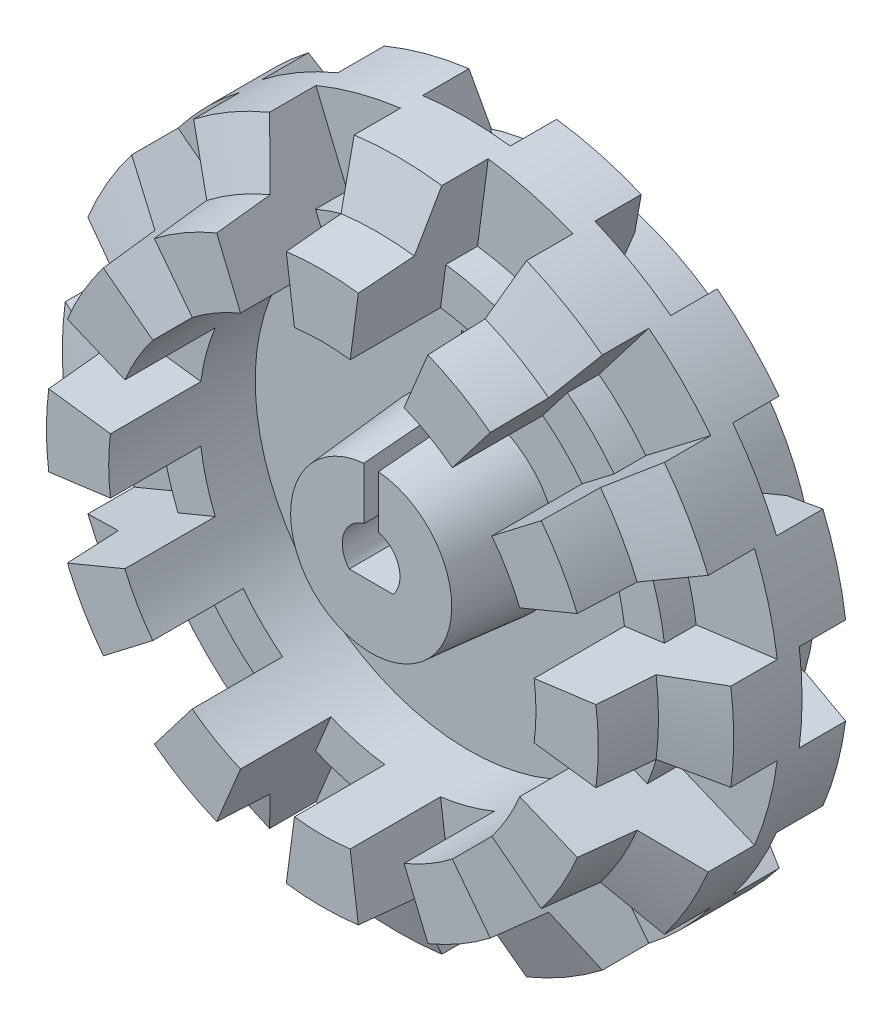
from build123d import *
from build123d.topology import SkipClean

# Parameters (mm, degrees)
SKETCH1_R           = 17.4625
BOSS_EXTRUDE1_DEPTH = 1.143
BOSS_EXTRUDE2_DEPTH = 6.35
SKETCH4_R           = 4.6355
BOSS_EXTRUDE3_DEPTH = 3.81
SKETCH5_R           = 4.064
BOSS_EXTRUDE4_DEPTH = 5.08
BOSS_EXTRUDE5_START = 3.175
BOSS_EXTRUDE5_DEPTH = 3.175
BOSS_EXTRUDE6_START = 5.08
SKETCH7_R           = 13.081
SKETCH7_R_2         = 10.414
BOSS_EXTRUDE6_DEPTH = 5.08
SKETCH11_R          = 13.208
SKETCH11_R_2        = 11.1125
BOSS_EXTRUDE7_DEPTH = 1.651
BOSS_EXTRUDE8_START = 1.27
SKETCH12_R          = 10.414
BOSS_EXTRUDE8_DEPTH = 1.27
DRAFT2_ANGLE        = 5
CUT_EXTRUDE1_DEPTH  = 27.655935577
CUT_EXTRUDE2_START  = -1.27
SKETCH13_R          = 11.1125
SKETCH13_R_2        = 4.6355
CUT_EXTRUDE2_DEPTH  = 1.27


# Read off the part's stored shape, not the designer's step: Draft1
with BuildPart() as part:
    # Sketch1 → Boss-Extrude1 (new body)
    with BuildSketch(Plane.XY):
        Circle(SKETCH1_R)
    extrude(amount=BOSS_EXTRUDE1_DEPTH)

    # Sketch2 → Boss-Extrude2 (add)
    with BuildSketch(Plane.XY.offset(1.143)):
        with BuildLine():
            ThreePointArc((-1.450472311, 11.017431022), (0, 11.1125), (1.450472311, 11.017431022))
            Line((1.450472311, 11.017431022), (2.279313632, 17.313105892))
            ThreePointArc((2.279313632, 17.313105892), (0, 17.4625), (-2.279313632, 17.313105892))
            Line((-2.279313632, 17.313105892), (-1.450472311, 11.017431022))
        make_face()
        with BuildLine():
            ThreePointArc((4.252569642, 10.266611305), (5.55625, 9.6237073), (6.76486138, 8.816138994))
            Line((6.76486138, 8.816138994), (10.630496454, 13.853932705))
            ThreePointArc((10.630496454, 13.853932705), (8.73125, 15.122968614), (6.682609438, 16.133246336))
            Line((6.682609438, 16.133246336), (4.252569642, 10.266611305))
        make_face()
        with BuildLine():
            ThreePointArc((8.816138994, 6.76486138), (9.6237073, 5.55625), (10.266611305, 4.252569642))
            Line((10.266611305, 4.252569642), (16.133246336, 6.682609438))
            ThreePointArc((16.133246336, 6.682609438), (15.122968614, 8.73125), (13.853932705, 10.630496454))
            Line((13.853932705, 10.630496454), (8.816138994, 6.76486138))
        make_face()
        with BuildLine():
            ThreePointArc((11.017431022, 1.450472311), (11.1125, 0), (11.017431022, -1.450472311))
            Line((11.017431022, -1.450472311), (17.313105892, -2.279313632))
            ThreePointArc((17.313105892, -2.279313632), (17.4625, 0), (17.313105892, 2.279313632))
            Line((17.313105892, 2.279313632), (11.017431022, 1.450472311))
        make_face()
        with BuildLine():
            ThreePointArc((10.266611305, -4.252569642), (9.6237073, -5.55625), (8.816138994, -6.76486138))
            Line((8.816138994, -6.76486138), (13.853932705, -10.630496454))
            ThreePointArc((13.853932705, -10.630496454), (15.122968614, -8.73125), (16.133246336, -6.682609438))
            Line((16.133246336, -6.682609438), (10.266611305, -4.252569642))
        make_face()
        with BuildLine():
            ThreePointArc((6.76486138, -8.816138994), (5.55625, -9.6237073), (4.252569642, -10.266611305))
            Line((4.252569642, -10.266611305), (6.682609438, -16.133246336))
            ThreePointArc((6.682609438, -16.133246336), (8.73125, -15.122968614), (10.630496454, -13.853932705))
            Line((10.630496454, -13.853932705), (6.76486138, -8.816138994))
        make_face()
        with BuildLine():
            ThreePointArc((1.450472311, -11.017431022), (0, -11.1125), (-1.450472311, -11.017431022))
            Line((-1.450472311, -11.017431022), (-2.279313632, -17.313105892))
            ThreePointArc((-2.279313632, -17.313105892), (0, -17.4625), (2.279313632, -17.313105892))
            Line((2.279313632, -17.313105892), (1.450472311, -11.017431022))
        make_face()
        with BuildLine():
            ThreePointArc((-4.252569642, -10.266611305), (-5.55625, -9.6237073), (-6.76486138, -8.816138994))
            Line((-6.76486138, -8.816138994), (-10.630496454, -13.853932705))
            ThreePointArc((-10.630496454, -13.853932705), (-8.73125, -15.122968614), (-6.682609438, -16.133246336))
            Line((-6.682609438, -16.133246336), (-4.252569642, -10.266611305))
        make_face()
        with BuildLine():
            ThreePointArc((-8.816138994, -6.76486138), (-9.6237073, -5.55625), (-10.266611305, -4.252569642))
            Line((-10.266611305, -4.252569642), (-16.133246336, -6.682609438))
            ThreePointArc((-16.133246336, -6.682609438), (-15.122968614, -8.73125), (-13.853932705, -10.630496454))
            Line((-13.853932705, -10.630496454), (-8.816138994, -6.76486138))
        make_face()
        with BuildLine():
            ThreePointArc((-11.017431022, -1.450472311), (-11.1125, 0), (-11.017431022, 1.450472311))
            Line((-11.017431022, 1.450472311), (-17.313105892, 2.279313632))
            ThreePointArc((-17.313105892, 2.279313632), (-17.4625, 0), (-17.313105892, -2.279313632))
            Line((-17.313105892, -2.279313632), (-11.017431022, -1.450472311))
        make_face()
        with BuildLine():
            ThreePointArc((-10.266611305, 4.252569642), (-9.6237073, 5.55625), (-8.816138994, 6.76486138))
            Line((-8.816138994, 6.76486138), (-13.853932705, 10.630496454))
            ThreePointArc((-13.853932705, 10.630496454), (-15.122968614, 8.73125), (-16.133246336, 6.682609438))
            Line((-16.133246336, 6.682609438), (-10.266611305, 4.252569642))
        make_face()
        with BuildLine():
            ThreePointArc((-6.76486138, 8.816138994), (-5.55625, 9.6237073), (-4.252569642, 10.266611305))
            Line((-4.252569642, 10.266611305), (-6.682609438, 16.133246336))
            ThreePointArc((-6.682609438, 16.133246336), (-8.73125, 15.122968614), (-10.630496454, 13.853932705))
            Line((-10.630496454, 13.853932705), (-6.76486138, 8.816138994))
        make_face()
    extrude(amount=BOSS_EXTRUDE2_DEPTH)

    # Sketch4 → Boss-Extrude3 (add)
    with BuildSketch(Plane.XY.offset(1.143)):
        with Locations(Location((0, 0, 0), (0, 0, 180))):
            Circle(SKETCH4_R)
    extrude(amount=BOSS_EXTRUDE3_DEPTH)

    # Sketch5 → Boss-Extrude4 (add)
    with BuildSketch(Plane(origin=(0, 0, 0), x_dir=(-1, 0, 0), z_dir=(0, 0, -1))):
        with Locations(Location((0, 0, 0), (0, 0, 180))):
            Circle(SKETCH5_R)
    extrude(amount=BOSS_EXTRUDE4_DEPTH)

    # Sketch6 → Boss-Extrude5 (add)
    with SkipClean():  # the faces are left unmerged after this step: merging them gives an invalid solid
        with BuildSketch(Plane(origin=(0, 0, 0), x_dir=(-1, 0, 0), z_dir=(0, 0, -1)).offset(BOSS_EXTRUDE5_START)):
            with BuildLine():
                Line((-1.359299766, 10.324906786), (-2.279313632, 17.313105892))
                ThreePointArc((-2.279313632, 17.313105892), (-4.519627575, 16.867479742), (-6.682609438, 16.133246336))
                Line((-6.682609438, 16.133246336), (-3.985265265, 9.621281452))
                ThreePointArc((-3.985265265, 9.621281452), (-2.695341536, 10.059151555), (-1.359299766, 10.324906786))
            make_face()
            with BuildLine():
                ThreePointArc((6.682609438, 16.133246336), (4.519627575, 16.867479742), (2.279313632, 17.313105892))
                Line((2.279313632, 17.313105892), (1.359299766, 10.324906786))
                ThreePointArc((1.359299766, 10.324906786), (2.695341536, 10.059151555), (3.985265265, 9.621281452))
                Line((3.985265265, 9.621281452), (6.682609438, 16.133246336))
            make_face()
            with BuildLine():
                ThreePointArc((13.853932705, 10.630496454), (12.347852166, 12.347852166), (10.630496454, 13.853932705))
                Line((10.630496454, 13.853932705), (6.339641522, 8.261981686))
                ThreePointArc((6.339641522, 8.261981686), (7.363810019, 7.363810019), (8.261981686, 6.339641522))
                Line((8.261981686, 6.339641522), (13.853932705, 10.630496454))
            make_face()
            with BuildLine():
                Line((16.133246336, 6.682609438), (9.621281452, 3.985265265))
                ThreePointArc((9.621281452, 3.985265265), (10.059151555, 2.695341536), (10.324906786, 1.359299766))
                Line((10.324906786, 1.359299766), (17.313105892, 2.279313632))
                ThreePointArc((17.313105892, 2.279313632), (16.867479742, 4.519627575), (16.133246336, 6.682609438))
            make_face()
            with BuildLine():
                Line((17.313105892, -2.279313632), (10.324906786, -1.359299766))
                ThreePointArc((10.324906786, -1.359299766), (10.059151555, -2.695341536), (9.621281452, -3.985265265))
                Line((9.621281452, -3.985265265), (16.133246336, -6.682609438))
                ThreePointArc((16.133246336, -6.682609438), (16.867479742, -4.519627575), (17.313105892, -2.279313632))
            make_face()
            with BuildLine():
                Line((13.853932705, -10.630496454), (8.261981686, -6.339641522))
                ThreePointArc((8.261981686, -6.339641522), (7.363810019, -7.363810019), (6.339641522, -8.261981686))
                Line((6.339641522, -8.261981686), (10.630496454, -13.853932705))
                ThreePointArc((10.630496454, -13.853932705), (12.347852166, -12.347852166), (13.853932705, -10.630496454))
            make_face()
            with BuildLine():
                Line((6.682609438, -16.133246336), (3.985265265, -9.621281452))
                ThreePointArc((3.985265265, -9.621281452), (2.695341536, -10.059151555), (1.359299766, -10.324906786))
                Line((1.359299766, -10.324906786), (2.279313632, -17.313105892))
                ThreePointArc((2.279313632, -17.313105892), (4.519627575, -16.867479742), (6.682609438, -16.133246336))
            make_face()
            with BuildLine():
                Line((-2.279313632, -17.313105892), (-1.359299766, -10.324906786))
                ThreePointArc((-1.359299766, -10.324906786), (-2.695341536, -10.059151555), (-3.985265265, -9.621281452))
                Line((-3.985265265, -9.621281452), (-6.682609438, -16.133246336))
                ThreePointArc((-6.682609438, -16.133246336), (-4.519627575, -16.867479742), (-2.279313632, -17.313105892))
            make_face()
            with BuildLine():
                Line((-10.630496454, -13.853932705), (-6.339641522, -8.261981686))
                ThreePointArc((-6.339641522, -8.261981686), (-7.363810019, -7.363810019), (-8.261981686, -6.339641522))
                Line((-8.261981686, -6.339641522), (-13.853932705, -10.630496454))
                ThreePointArc((-13.853932705, -10.630496454), (-12.347852166, -12.347852166), (-10.630496454, -13.853932705))
            make_face()
            with BuildLine():
                Line((-16.133246336, -6.682609438), (-9.621281452, -3.985265265))
                ThreePointArc((-9.621281452, -3.985265265), (-10.059151555, -2.695341536), (-10.324906786, -1.359299766))
                Line((-10.324906786, -1.359299766), (-17.313105892, -2.279313632))
                ThreePointArc((-17.313105892, -2.279313632), (-16.867479742, -4.519627575), (-16.133246336, -6.682609438))
            make_face()
            with BuildLine():
                Line((-17.313105892, 2.279313632), (-10.324906786, 1.359299766))
                ThreePointArc((-10.324906786, 1.359299766), (-10.059151555, 2.695341536), (-9.621281452, 3.985265265))
                Line((-9.621281452, 3.985265265), (-16.133246336, 6.682609438))
                ThreePointArc((-16.133246336, 6.682609438), (-16.867479742, 4.519627575), (-17.313105892, 2.279313632))
            make_face()
            with BuildLine():
                Line((-13.853932705, 10.630496454), (-8.261981686, 6.339641522))
                ThreePointArc((-8.261981686, 6.339641522), (-7.363810019, 7.363810019), (-6.339641522, 8.261981686))
                Line((-6.339641522, 8.261981686), (-10.630496454, 13.853932705))
                ThreePointArc((-10.630496454, 13.853932705), (-12.347852166, 12.347852166), (-13.853932705, 10.630496454))
            make_face()
        extrude(amount=-BOSS_EXTRUDE5_DEPTH)

    # Sketch7 → Boss-Extrude6 (add)
    with SkipClean():  # the faces are left unmerged after this step: merging them gives an invalid solid
        with BuildSketch(Plane(origin=(0, 0, 0), x_dir=(-1, 0, 0), z_dir=(0, 0, -1)).offset(BOSS_EXTRUDE6_START)):
            with Locations(Location((0, 0, 0), (0, 0, 187.5))):
                Circle(SKETCH7_R)
            Circle(SKETCH7_R_2, mode=Mode.SUBTRACT)
        extrude(amount=-BOSS_EXTRUDE6_DEPTH)

    # Sketch9 → Cut-Revolve1 (revolve, cut)
    with SkipClean():  # the faces are left unmerged after this step: merging them gives an invalid solid
        with BuildSketch(Plane(origin=(0, 0, 0), x_dir=(1, 0, 0), z_dir=(0, 1, 0)), mode=Mode.PRIVATE) as cut_revolve1_sk:
            Polygon((17.4625, 2.413), (17.4625, 3.175), (14.605, 3.175), align=None)
            Polygon((14.605, -4.612051731), (17.4625, -4.612051731), (17.4625, -3.556), align=None)
            Polygon((17.4625, -7.493), (14.352949686, -7.493), (14.605, -4.612051731), (17.4625, -4.612051731), align=None)
        revolve(cut_revolve1_sk.sketch.rotate(Axis((0, 0, 0), (0, 0, -1)), 172.5), axis=Axis((0, 0, 0), (0, 0, -1)), mode=Mode.SUBTRACT)

    # Sketch11 → Boss-Extrude7 (add)
    with SkipClean():  # the faces are left unmerged after this step: merging them gives an invalid solid
        with BuildSketch(Plane.XY.offset(1.143)):
            Circle(SKETCH11_R)
            with Locations(Location((0, 0, 0), (0, 0, 187.5))):
                Circle(SKETCH11_R_2, mode=Mode.SUBTRACT)
        extrude(amount=BOSS_EXTRUDE7_DEPTH)

    # Sketch12 → Boss-Extrude8 (add)
    with SkipClean():  # the faces are left unmerged after this step: merging them gives an invalid solid
        with BuildSketch(Plane(origin=(0, 0, 0), x_dir=(-1, 0, 0), z_dir=(0, 0, -1)).offset(BOSS_EXTRUDE8_START)):
            Circle(SKETCH12_R)
        extrude(amount=-BOSS_EXTRUDE8_DEPTH)

    # Draft2
    draft2_faces = [part.faces().sort_by_distance(p)[0] for p in [
        (-4.064, 0, -3.175),
    ]]
    draft(draft2_faces, Plane(origin=(0, 0, -1.27), x_dir=(-1, 0, 0), z_dir=(0, 0, -1)), DRAFT2_ANGLE)

    # Sketch10 → Cut-Extrude1 (cut, through all)
    with SkipClean():  # the faces are left unmerged after this step: merging them gives an invalid solid
        with BuildSketch(Plane.XY.offset(4.953)):
            with BuildLine():
                Line((-1.143, -0.971365534), (1.143, -0.971365534))
                ThreePointArc((1.143, -0.971365534), (1.407924004, -0.517445649), (1.5, 0))
                ThreePointArc((1.5, 0), (1.187749974, 0.916105889), (0.381, 1.450806328))
                Line((0.381, 1.450806328), (0.381, 0))
                Line((0.381, 0), (0, 0))
                Line((0, 0), (-0.381, 0))
                Line((-0.381, 0), (-0.381, 1.450806328))
                ThreePointArc((-0.381, 1.450806328), (-1.43086447, 0.450140943), (-1.143, -0.971365534))
            make_face()
            with BuildLine():
                ThreePointArc((0, 1.5), (-0.192081374, 1.487650747), (-0.381, 1.450806328))
                Line((-0.381, 1.450806328), (-0.381, 0))
                Line((-0.381, 0), (0, 0))
                Line((0, 0), (0, 1.5))
            make_face()
            with BuildLine():
                Line((0.381, 0), (0.381, 1.450806328))
                ThreePointArc((0.381, 1.450806328), (0.192081374, 1.487650747), (0, 1.5))
                Line((0, 1.5), (0, 0))
                Line((0, 0), (0.381, 0))
            make_face()
            with BuildLine():
                ThreePointArc((0, 1.5), (0.192081374, 1.487650747), (0.381, 1.450806328))
                Line((0.381, 1.450806328), (0.381, 4.619815932))
                ThreePointArc((0.381, 4.619815932), (0.190661342, 4.631577323), (0, 4.6355))
                Line((0, 4.6355), (0, 1.5))
            make_face()
            with BuildLine():
                Line((-0.381, 4.619815932), (-0.381, 1.450806328))
                ThreePointArc((-0.381, 1.450806328), (-0.192081374, 1.487650747), (0, 1.5))
                Line((0, 1.5), (0, 4.6355))
                ThreePointArc((0, 4.6355), (-0.190661342, 4.631577323), (-0.381, 4.619815932))
            make_face()
            with BuildLine():
                Line((-0.381, 7.62), (-0.381, 4.619815932))
                ThreePointArc((-0.381, 4.619815932), (-0.190661342, 4.631577323), (0, 4.6355))
                Line((0, 4.6355), (0, 7.62))
                Line((0, 7.62), (-0.381, 7.62))
            make_face()
            with BuildLine():
                ThreePointArc((0, 4.6355), (0.190661342, 4.631577323), (0.381, 4.619815932))
                Line((0.381, 4.619815932), (0.381, 7.62))
                Line((0.381, 7.62), (0, 7.62))
                Line((0, 7.62), (0, 4.6355))
            make_face()
        extrude(amount=-CUT_EXTRUDE1_DEPTH, mode=Mode.SUBTRACT)

    # Sketch13 → Cut-Extrude2 (cut)
    with SkipClean():  # the faces are left unmerged after this step: merging them gives an invalid solid
        with BuildSketch(Plane.XY.offset(1.143).offset(CUT_EXTRUDE2_START)):
            with Locations(Location((0, 0, 0), (0, 0, 187.5))):
                Circle(SKETCH13_R)
            Circle(SKETCH13_R_2, mode=Mode.SUBTRACT)
        extrude(amount=CUT_EXTRUDE2_DEPTH, mode=Mode.SUBTRACT)

    # Draft1 outline → Draft1 (revolve, cut)
    with SkipClean():  # the faces are left unmerged after this step: merging them gives an invalid solid
        with BuildSketch(Plane.XZ):
            Polygon((4.6355, 4.953), (4.191057589, 4.953), (4.6355, -0.127), align=None)
        revolve(axis=Axis((0, 0, 0), (0, 0, 1)), mode=Mode.SUBTRACT)


solid = part.part
